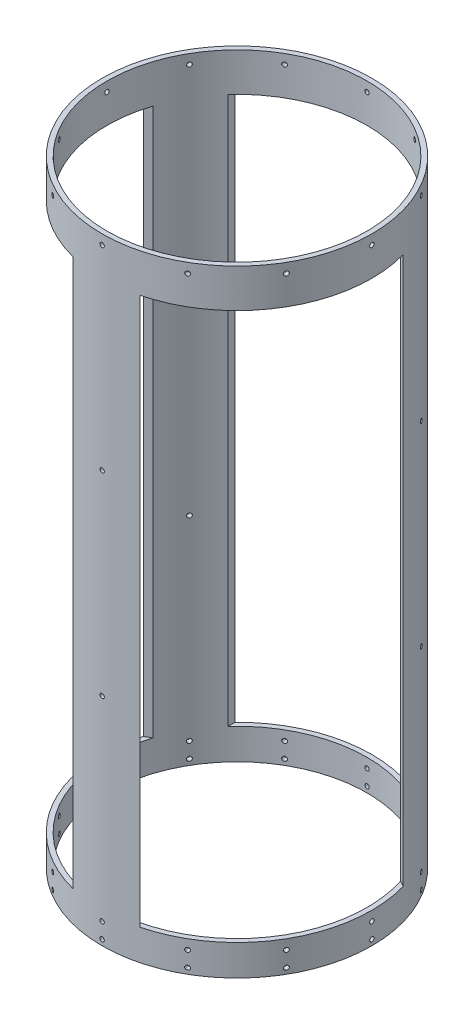
from build123d import *

# Parameters (mm, degrees)
SKETCH1_R               = 88.9
SKETCH1_R_2             = 85.725
BOSS_EXTRUDE1_DEPTH     = 203.2
CUT_EXTRUDE1_REACH      = 240.949
CUT_EXTRUDE1_END_RADIUS = 88.9
SKETCH2_W               = 127
SKETCH2_H               = 360.68
CIRPATTERN1_COUNT       = 3
SKETCH3_R               = 1.4351
CUT_EXTRUDE2_DEPTH      = 15.24
CIRPATTERN2_COUNT       = 12
SKETCH4_R               = 1.4351
CUT_EXTRUDE3_DEPTH      = 15.24
CIRPATTERN3_COUNT       = 12
SKETCH5_R               = 1.4351
CUT_EXTRUDE4_DEPTH      = 35.56
CIRPATTERN4_COUNT       = 3


with BuildPart() as part:
    # Sketch1 → Boss-Extrude1 (new, symmetric)
    with BuildSketch(Plane(origin=(0, 0, 0), x_dir=(1, 0, 0), z_dir=(0, 1, 0))):
        Circle(SKETCH1_R)
        Circle(SKETCH1_R_2, mode=Mode.SUBTRACT)
    extrude(amount=BOSS_EXTRUDE1_DEPTH, both=True)

    # Cut-Extrude1: up to this cylinder (the profile starts inside it)
    cut_extrude1_end = Plane(origin=(0, -2.54, 0), z_dir=(0, -1, 0)) * Cylinder(CUT_EXTRUDE1_END_RADIUS, 660.698, mode=Mode.PRIVATE)
    # Sketch2 → Cut-Extrude1 (cut, up to the surface)
    with BuildSketch(Plane.XY, mode=Mode.PRIVATE) as cut_extrude1_sk1:
        with Locations((0, -2.54)):
            Rectangle(SKETCH2_W, SKETCH2_H)
    cut_extrude1_tool1 = extrude(cut_extrude1_sk1.sketch, amount=-CUT_EXTRUDE1_REACH, mode=Mode.PRIVATE) & cut_extrude1_end
    cut_extrude1 = cut_extrude1_tool1.solids().sort_by_distance((0, -2.54, 0))[0]
    add(cut_extrude1, mode=Mode.SUBTRACT)

    # CirPattern1: Cut-Extrude1 ×3 about axis
    cirpattern1_axis = Axis((0, 203.2, 0), (0, -1, 0))
    for i in range(1, CIRPATTERN1_COUNT):
        add(cut_extrude1.rotate(cirpattern1_axis, i * 360 / CIRPATTERN1_COUNT), mode=Mode.SUBTRACT)

    # Sketch3 → Cut-Extrude2 (cut)
    with BuildSketch(Plane(origin=(88.9, 0, 0), x_dir=(0, 0, -1), z_dir=(1, 0, 0))):
        with Locations((0, -199.39)):
            Circle(SKETCH3_R)
        with Locations((0, -189.23)):
            Circle(SKETCH3_R)
    cut_extrude2 = extrude(amount=-CUT_EXTRUDE2_DEPTH, mode=Mode.SUBTRACT)

    # CirPattern2: Cut-Extrude2 ×12 about axis
    cirpattern2_axis = Axis((0, 203.2, 0), (0, -1, 0))
    for i in range(1, CIRPATTERN2_COUNT):
        add(cut_extrude2.rotate(cirpattern2_axis, i * 360 / CIRPATTERN2_COUNT), mode=Mode.SUBTRACT)

    # Sketch4 → Cut-Extrude3 (cut)
    with BuildSketch(Plane(origin=(88.9, 0, 0), x_dir=(0, 0, -1), z_dir=(1, 0, 0))):
        with Locations((0, 196.85)):
            Circle(SKETCH4_R)
    cut_extrude3 = extrude(amount=-CUT_EXTRUDE3_DEPTH, mode=Mode.SUBTRACT)

    # CirPattern3: Cut-Extrude3 ×12 about axis
    cirpattern3_axis = Axis((0, 203.2, 0), (0, -1, 0))
    for i in range(1, CIRPATTERN3_COUNT):
        add(cut_extrude3.rotate(cirpattern3_axis, i * 360 / CIRPATTERN3_COUNT), mode=Mode.SUBTRACT)

    # Sketch5 → Cut-Extrude4 (cut)
    with BuildSketch(Plane.XY.offset(88.9)):
        with Locations((0, 68.1736)):
            Circle(SKETCH5_R)
        with Locations((0, -60.5536)):
            Circle(SKETCH5_R)
    cut_extrude4 = extrude(amount=-CUT_EXTRUDE4_DEPTH, mode=Mode.SUBTRACT)

    # CirPattern4: Cut-Extrude4 ×3 about axis
    cirpattern4_axis = Axis((0, 203.2, 0), (0, -1, 0))
    for i in range(1, CIRPATTERN4_COUNT):
        add(cut_extrude4.rotate(cirpattern4_axis, i * 360 / CIRPATTERN4_COUNT), mode=Mode.SUBTRACT)


solid = part.part
